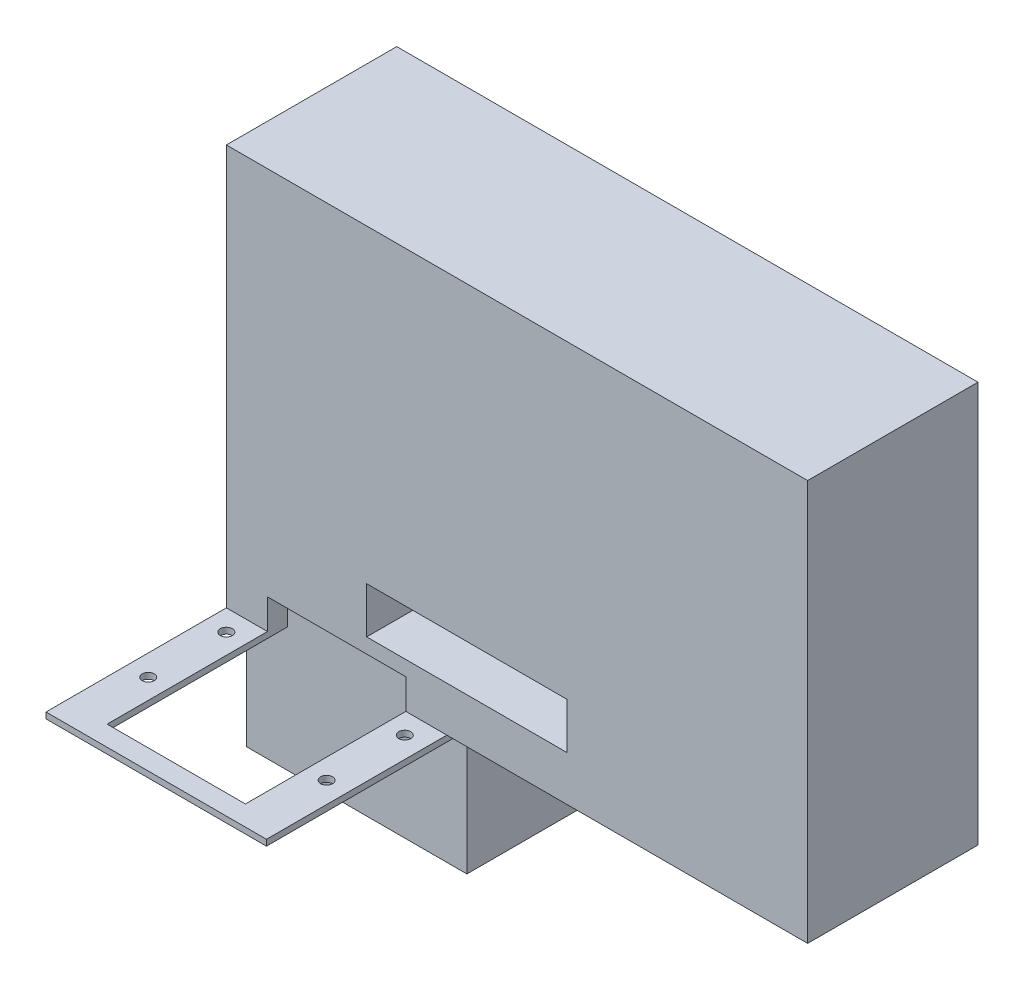
from build123d import *

# Parameters (mm, degrees)
CROQUIS1_W              = 110
CROQUIS1_H              = 65
SALIENTE_EXTRUIR1_DEPTH = 75
CROQUIS3_W              = 110
CROQUIS3_H              = 3
SALIENTE_EXTRUIR2_DEPTH = 70
CROQUIS4_R              = 3
CORTAR_EXTRUIR1_DEPTH   = 70
SALIENTE_EXTRUIR3_DEPTH = 3
CROQUIS7_W              = 290
CROQUIS7_H              = 85
SALIENTE_EXTRUIR4_DEPTH = 200
CROQUIS8_W              = 69
CROQUIS8_H              = 15
CORTAR_EXTRUIR2_DEPTH   = 10
CORTAR_EXTRUIR3_DEPTH   = 50


with BuildPart() as part:
    # Croquis1 → Saliente-Extruir1 (new body)
    with BuildSketch(Plane.XY):
        with Locations((-30.634930344, 26.158405172)):
            Rectangle(CROQUIS1_W, CROQUIS1_H)
    extrude(amount=SALIENTE_EXTRUIR1_DEPTH)

    # Croquis3 → Saliente-Extruir2 (add)
    with BuildSketch(Plane.XY.offset(75)):
        with Locations((-30.634930344, 57.158405172)):
            Rectangle(CROQUIS3_W, CROQUIS3_H)
    extrude(amount=SALIENTE_EXTRUIR2_DEPTH)

    # Croquis4 → Cortar-Extruir1 (cut)
    with BuildSketch(Plane.XZ.offset(-55.658405172)):
        with Locations((-75.134930344, 134.5)):
            Circle(CROQUIS4_R)
        with Locations((-75.134930344, 95.5)):
            Circle(CROQUIS4_R)
        with Locations((13.865069656, 134.5)):
            Circle(CROQUIS4_R)
        with Locations((13.865069656, 95.5)):
            Circle(CROQUIS4_R)
        Polygon((-65.134930344, 134.5), (-65.134930344, 75), (3.865069656, 75), (3.865069656, 138), (3.865069656, 145), (-65.134930344, 145), align=None)
    extrude(amount=-CORTAR_EXTRUIR1_DEPTH, mode=Mode.SUBTRACT)

    # Croquis6 → Saliente-Extruir3 (add)
    with BuildSketch(Plane(origin=(0, 58.658405172, 0), x_dir=(1, 0, 0), z_dir=(0, 1, 0))):
        Polygon((-85.634930344, -145), (-85.634930344, -175), (24.365069656, -175), (24.365069656, -145), (3.865069656, -145), (3.865069656, -165), (-65.134930344, -165), (-65.134930344, -145), align=None)
    extrude(amount=-SALIENTE_EXTRUIR3_DEPTH)

    # Croquis7 → Saliente-Extruir4 (add)
    with BuildSketch(Plane(origin=(0, 58.658405172, 0), x_dir=(1, 0, 0), z_dir=(0, 1, 0))):
        with Locations((59.365069656, -42.5)):
            Rectangle(CROQUIS7_W, CROQUIS7_H)
    extrude(amount=SALIENTE_EXTRUIR4_DEPTH)

    # Croquis8 → Cortar-Extruir2 (cut)
    with BuildSketch(Plane.XY.offset(85)):
        with Locations((-30.634930344, 66.158405172)):
            Rectangle(CROQUIS8_W, CROQUIS8_H)
    extrude(amount=-CORTAR_EXTRUIR2_DEPTH, mode=Mode.SUBTRACT)

    # Croquis10 → Cortar-Extruir3 (cut)
    with BuildSketch(Plane.XY.offset(85)):
        Polygon((-0.634930344, 81.0941562), (-15.634930344, 81.0941562), (-15.634930344, 104.0941562), (-0.634930344, 104.0941562), (69.365069656, 104.0941562), (84.365069656, 104.0941562), (84.365069656, 81.0941562), (69.365069656, 81.0941562), align=None)
    extrude(amount=-CORTAR_EXTRUIR3_DEPTH, mode=Mode.SUBTRACT)


solid = part.part
